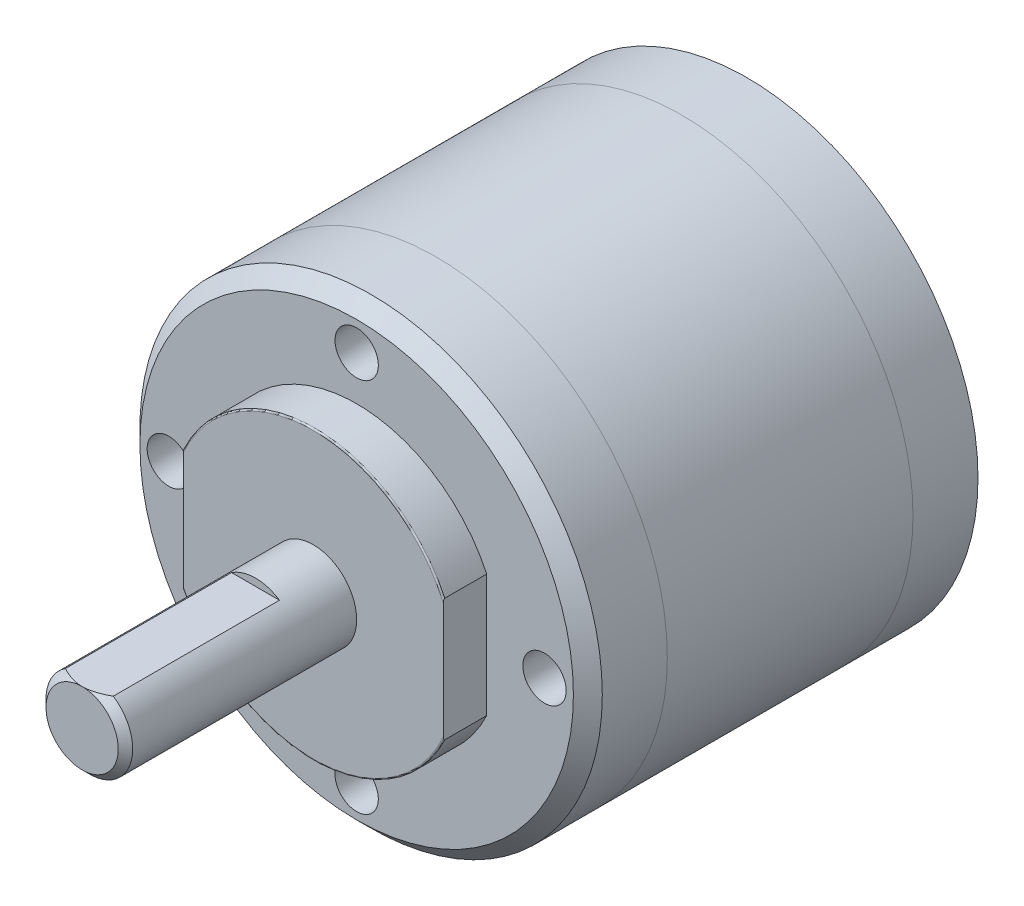
from build123d import *

# Parameters (mm, degrees)
SKETCH_1_R          = 16
EXTRUDE_1_DEPTH     = 4.5
SKETCH_2_R          = 16
EXTRUDE_2_DEPTH     = 17
SKETCH_3_R          = 16
EXTRUDE_3_DEPTH     = 5.5
CHAMFER_1_SIZE      = 1
EXTRUDE_4_DEPTH     = 3
FILLET_1_R          = 0.1
SKETCH_5_R          = 3
EXTRUDE_5_DEPTH     = 16
CUT_EXTRUDE_1_DEPTH = 12
CHAMFER_2_SIZE      = 0.5
SKETCH_7_R          = 1.5
CUT_EXTRUDE_2_DEPTH = 4
SKETCH_8_R          = 6
SKETCH_8_R_2        = 1.6
CUT_EXTRUDE_3_DEPTH = 10
CHAMFER_3_SIZE      = 0.3


with BuildPart() as part:
    # ｽｹｯﾁ1 → ﾎﾞｽ - 押し出し1 (new body)
    with BuildSketch(Plane.XY):
        Circle(SKETCH_1_R)
    extrude(amount=EXTRUDE_1_DEPTH)


with BuildPart() as body_2:
    # ｽｹｯﾁ2 → ﾎﾞｽ - 押し出し2 (new body)
    with BuildSketch(Plane.XY.offset(4.5)):
        Circle(SKETCH_2_R)
    extrude(amount=EXTRUDE_2_DEPTH)


with BuildPart() as body_3:
    # ｽｹｯﾁ3 → ﾎﾞｽ - 押し出し3 (new body)
    with BuildSketch(Plane.XY.offset(21.5)):
        Circle(SKETCH_3_R)
    extrude(amount=EXTRUDE_3_DEPTH)

    # 面取り1
    chamfer_1_edges = [body_3.edges().sort_by_distance(p)[0] for p in [
        (-16, 0, 27),
    ]]
    chamfer(chamfer_1_edges, length=CHAMFER_1_SIZE)

    # ｽｹｯﾁ4 → ﾎﾞｽ - 押し出し4 (add)
    with BuildSketch(Plane.XY.offset(27)):
        with BuildLine():
            Line((-9, 4.242935305), (-9, -4.242935305))
            ThreePointArc((-9, -4.242935305), (0, -9.95), (9, -4.242935305))
            Line((9, -4.242935305), (9, 4.242935305))
            ThreePointArc((9, 4.242935305), (0, 9.95), (-9, 4.242935305))
        make_face()
    extrude(amount=EXTRUDE_4_DEPTH)

    # ﾌｨﾚｯﾄ1
    fillet_1_edges = [body_3.edges().sort_by_distance(p)[0] for p in [
        (0, 9.95, 30),
        (0, -9.95, 30),
    ]]
    fillet(fillet_1_edges, radius=FILLET_1_R)

    # ｽｹｯﾁ5 → ﾎﾞｽ - 押し出し5 (add)
    with BuildSketch(Plane.XY.offset(30)):
        Circle(SKETCH_5_R)
    extrude(amount=EXTRUDE_5_DEPTH)

    # ｽｹｯﾁ6 → ｶｯﾄ - 押し出し1 (cut)
    with BuildSketch(Plane.XY.offset(46)):
        with BuildLine():
            Line((-1.658312395, 2.5), (1.658312395, 2.5))
            ThreePointArc((1.658312395, 2.5), (0, 3), (-1.658312395, 2.5))
        make_face()
    extrude(amount=-CUT_EXTRUDE_1_DEPTH, mode=Mode.SUBTRACT)

    # 面取り2
    chamfer_2_edges = [body_3.edges().sort_by_distance(p)[0] for p in [
        (-1.418637165, -2.643382037, 46),
    ]]
    chamfer(chamfer_2_edges, length=CHAMFER_2_SIZE - 0.0001)  # a hair under: the kernel refuses the full size

    # ｽｹｯﾁ7 → ｶｯﾄ - 押し出し2 (cut)
    with BuildSketch(Plane.XY.offset(27)):
        with Locations((0, 13)):
            Circle(SKETCH_7_R)
        with Locations((13, 0)):
            Circle(SKETCH_7_R)
        with Locations((0, -13)):
            Circle(SKETCH_7_R)
        with Locations((-13, 0)):
            Circle(SKETCH_7_R)
    extrude(amount=-CUT_EXTRUDE_2_DEPTH, mode=Mode.SUBTRACT)


with BuildPart() as cut_extrude_3_tool:
    # ｽｹｯﾁ8 → ｶｯﾄ - 押し出し3 (new body)
    with BuildSketch(Plane(origin=(0, 0, 0), x_dir=(-1, 0, 0), z_dir=(0, 0, -1))):
        Circle(SKETCH_8_R)
        with Locations((12.5, 0)):
            Circle(SKETCH_8_R_2)
        with Locations((-12.5, 0)):
            Circle(SKETCH_8_R_2)
        with Locations((0, 8)):
            Circle(SKETCH_8_R_2)
        with Locations((0, -8)):
            Circle(SKETCH_8_R_2)
    extrude(amount=-CUT_EXTRUDE_3_DEPTH)


with BuildPart() as part_1:
    add(part.part)

    # ｶｯﾄ - 押し出し3: cut by cut_extrude_3_tool
    add(cut_extrude_3_tool.part, mode=Mode.SUBTRACT)

    # 面取り3
    chamfer_3_edges = [part_1.edges().sort_by_distance(p)[0] for p in [
        (6, 0, 0),
    ]]
    chamfer(chamfer_3_edges, length=CHAMFER_3_SIZE)


with BuildPart() as body_2_1:
    add(body_2.part)

    # ｶｯﾄ - 押し出し3: cut by cut_extrude_3_tool
    add(cut_extrude_3_tool.part, mode=Mode.SUBTRACT)


solid = Compound([body_3.part, part_1.part, body_2_1.part])
